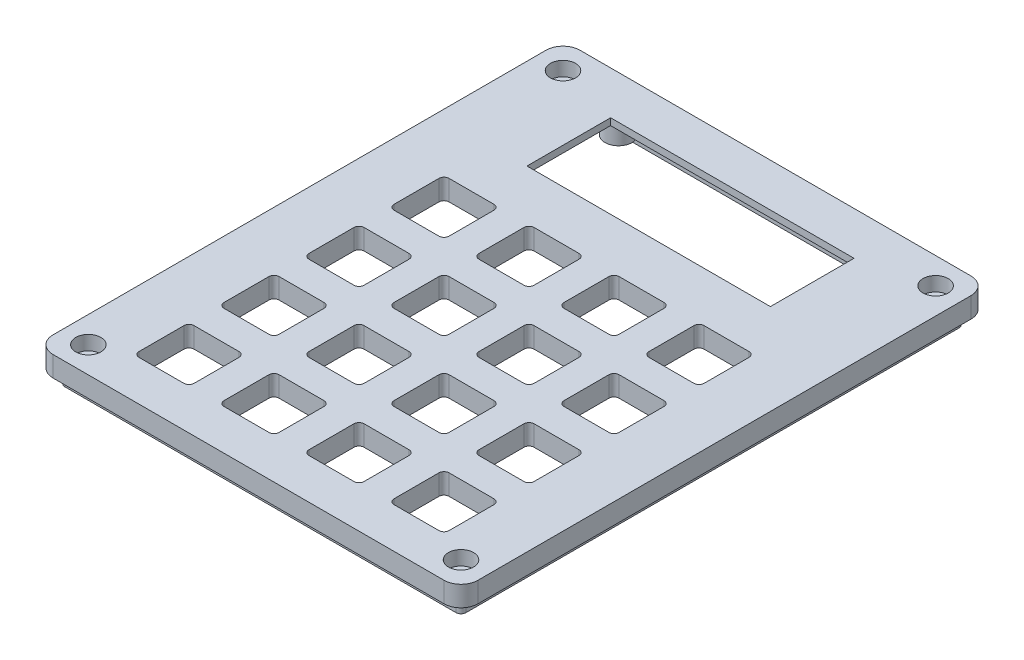
from build123d import *

# Parameters (mm, degrees)
BOSS_EXTRUDE1_DEPTH  = 6
CUT_EXTRUDE1_DEPTH   = 200.213453361
LPATTERN1_COUNT      = 4
LPATTERN1_PITCH      = 25
LPATTERN1_COUNT_DIR2 = 4
LPATTERN1_PITCH_DIR2 = 25
SKETCH4_W            = 71.6
SKETCH4_H            = 24.6
CUT_EXTRUDE2_DEPTH   = 200.213453361
SKETCH3_W            = 113.6
SKETCH3_H            = 143.6
BOSS_EXTRUDE2_DEPTH  = 4
HOLE2_D              = 4.5
HOLE2_DEPTH          = 10
HOLE2_CBORE_D        = 7.4
HOLE2_CBORE_DEPTH    = 4.2
HOLE2_TIP            = 1.351936393
SKETCH8_R            = 4
BOSS_EXTRUDE3_DEPTH  = 1
HOLE1_D              = 4.5
HOLE1_DEPTH          = 4.5
CUT_EXTRUDE3_START   = -4
CUT_EXTRUDE3_DEPTH   = 4


# Read off the part's stored shape, not the designer's step: Ø4.0mm Dowel Hole1
with BuildPart() as part:
    # Sketch1 → Boss-Extrude1 (new body)
    with BuildSketch(Plane(origin=(0, 0, 0), x_dir=(1, 0, 0), z_dir=(0, 1, 0))):
        with BuildLine():
            Line((-5, 0), (-120, 0))
            ThreePointArc((-120, 0), (-123.535533906, -1.464466094), (-125, -5))
            Line((-125, -5), (-125, -150))
            ThreePointArc((-125, -150), (-123.535533906, -153.535533906), (-120, -155))
            Line((-120, -155), (-5, -155))
            ThreePointArc((-5, -155), (-1.464466094, -153.535533906), (0, -150))
            Line((0, -150), (0, -5))
            ThreePointArc((0, -5), (-1.464466094, -1.464466094), (-5, 0))
        make_face()
    extrude(amount=BOSS_EXTRUDE1_DEPTH)

    # Sketch2 → Cut-Extrude1 (cut, through all)
    with BuildSketch(Plane(origin=(0, 6, 0), x_dir=(1, 0, 0), z_dir=(0, 1, 0))):
        with BuildLine():
            Line((-106.6, -143.1), (-93.4, -143.1))
            ThreePointArc((-93.4, -143.1), (-92.339339828, -142.660660172), (-91.9, -141.6))
            Line((-91.9, -141.6), (-91.9, -128.4))
            ThreePointArc((-91.9, -128.4), (-92.339339828, -127.339339828), (-93.4, -126.9))
            Line((-93.4, -126.9), (-106.6, -126.9))
            ThreePointArc((-106.6, -126.9), (-107.660660172, -127.339339828), (-108.1, -128.4))
            Line((-108.1, -128.4), (-108.1, -141.6))
            ThreePointArc((-108.1, -141.6), (-107.660660172, -142.660660172), (-106.6, -143.1))
        make_face()
    cut_extrude1 = extrude(amount=-CUT_EXTRUDE1_DEPTH, mode=Mode.SUBTRACT)

    # LPattern1: Cut-Extrude1 4 × 4
    with Locations(*[(i * LPATTERN1_PITCH, 0, -j * LPATTERN1_PITCH_DIR2) for i in range(LPATTERN1_COUNT) for j in range(LPATTERN1_COUNT_DIR2) if (i, j) != (0, 0)]):
        add(cut_extrude1, mode=Mode.SUBTRACT)

    # Sketch4 → Cut-Extrude2 (cut, through all)
    with BuildSketch(Plane(origin=(0, 6, 0), x_dir=(1, 0, 0), z_dir=(0, 1, 0))):
        with Locations((-62.5, -25)):
            Rectangle(SKETCH4_W, SKETCH4_H)
    extrude(amount=-CUT_EXTRUDE2_DEPTH, mode=Mode.SUBTRACT)

    # Sketch3 → Boss-Extrude2 (add)
    # profile 1 of 5: a face of its own
    with BuildSketch(Plane.XZ):
        with BuildLine():
            Line((-120, 3.5), (-5, 3.5))
            ThreePointArc((-5, 3.5), (-3.939339828, 3.939339828), (-3.5, 5))
            Line((-3.5, 5), (-3.5, 150))
            ThreePointArc((-3.5, 150), (-3.939339828, 151.060660172), (-5, 151.5))
            Line((-5, 151.5), (-120, 151.5))
            ThreePointArc((-120, 151.5), (-121.060660172, 151.060660172), (-121.5, 150))
            Line((-121.5, 150), (-121.5, 5))
            ThreePointArc((-121.5, 5), (-121.060660172, 3.939339828), (-120, 3.5))
        make_face()
        with Locations((-62.5, 77.5)):
            Rectangle(SKETCH3_W, SKETCH3_H, mode=Mode.SUBTRACT)
    # profile 2 of 5: a face of its own
    with BuildSketch(Plane.XZ):
        with BuildLine():
            Line((-7.7, 143.3), (-5.7, 143.3))
            Line((-5.7, 143.3), (-5.7, 149.3))
            Line((-5.7, 149.3), (-11.7, 149.3))
            Line((-11.7, 149.3), (-11.7, 147.3))
            ThreePointArc((-11.7, 147.3), (-10.528427125, 144.471572875), (-7.7, 143.3))
        make_face()
    # profile 3 of 5: a face of its own
    with BuildSketch(Plane.XZ):
        with BuildLine():
            Line((-119.3, 149.3), (-119.3, 143.3))
            Line((-119.3, 143.3), (-117.3, 143.3))
            ThreePointArc((-117.3, 143.3), (-114.471572875, 144.471572875), (-113.3, 147.3))
            Line((-113.3, 147.3), (-113.3, 149.3))
            Line((-113.3, 149.3), (-119.3, 149.3))
        make_face()
    # profile 4 of 5: a face of its own
    with BuildSketch(Plane.XZ):
        with BuildLine():
            Line((-11.7, 7.7), (-11.7, 5.7))
            Line((-11.7, 5.7), (-5.7, 5.7))
            Line((-5.7, 5.7), (-5.7, 11.7))
            Line((-5.7, 11.7), (-7.7, 11.7))
            ThreePointArc((-7.7, 11.7), (-10.528427125, 10.528427125), (-11.7, 7.7))
        make_face()
    # profile 5 of 5: a face of its own
    with BuildSketch(Plane.XZ):
        with BuildLine():
            Line((-113.3, 5.7), (-113.3, 7.7))
            ThreePointArc((-113.3, 7.7), (-114.471572875, 10.528427125), (-117.3, 11.7))
            Line((-117.3, 11.7), (-119.3, 11.7))
            Line((-119.3, 11.7), (-119.3, 5.7))
            Line((-119.3, 5.7), (-113.3, 5.7))
        make_face()
    extrude(amount=BOSS_EXTRUDE2_DEPTH)

    # Hole2
    with Locations(Plane(origin=(-117.3, 6, 7.7), x_dir=(0, 0, 1), z_dir=(0, 1, 0))):
        with Locations((0, 0), (0, 109.6), (139.6, 109.6), (139.6, 0)):
            CounterBoreHole(HOLE2_D / 2, HOLE2_CBORE_D / 2, HOLE2_CBORE_DEPTH, depth=HOLE2_DEPTH)
            with Locations((0, 0, -(HOLE2_DEPTH + HOLE2_TIP / 2))):  # 118° drill point
                Cone(0, HOLE2_D / 2, HOLE2_TIP, mode=Mode.SUBTRACT)

    # Ø4.0mm Dowel Hole1 outline → Ø4.0mm Dowel Hole1 (revolve, cut)
    with BuildSketch(Plane(origin=(-15, 0, 145), x_dir=(1, 0, 0), z_dir=(0, 0, 1))):
        Polygon((2.25, 4.5), (0, 5.851936393), (0, 0), (2.25, 0), align=None)
    revolve(axis=Axis((-15, 0, 145), (0, 1, 0)), mode=Mode.SUBTRACT)

    # 4.0mm Dowel Hole1 2 outline → 4.0mm Dowel Hole1 2 (revolve, cut)
    with BuildSketch(Plane(origin=(-60, 0, 145), x_dir=(1, 0, 0), z_dir=(0, 0, 1))):
        Polygon((2.25, 4.5), (0, 5.851936393), (0, 0), (2.25, 0), align=None)
    revolve(axis=Axis((-60, 0, 145), (0, 1, 0)), mode=Mode.SUBTRACT)

    # 4.0mm Dowel Hole1 3 outline → 4.0mm Dowel Hole1 3 (revolve, cut)
    with BuildSketch(Plane(origin=(-110, 0, 145), x_dir=(1, 0, 0), z_dir=(0, 0, 1))):
        Polygon((2.25, 4.5), (0, 5.851936393), (0, 0), (2.25, 0), align=None)
    revolve(axis=Axis((-110, 0, 145), (0, 1, 0)), mode=Mode.SUBTRACT)

    # 4.0mm Dowel Hole1 4 outline → 4.0mm Dowel Hole1 4 (revolve, cut)
    with BuildSketch(Plane(origin=(-110, 0, 95), x_dir=(1, 0, 0), z_dir=(0, 0, 1))):
        Polygon((2.25, 4.5), (0, 5.851936393), (0, 0), (2.25, 0), align=None)
    revolve(axis=Axis((-110, 0, 95), (0, 1, 0)), mode=Mode.SUBTRACT)

    # 4.0mm Dowel Hole1 5 outline → 4.0mm Dowel Hole1 5 (revolve, cut)
    with BuildSketch(Plane(origin=(-110, 0, 50), x_dir=(1, 0, 0), z_dir=(0, 0, 1))):
        Polygon((2.25, 4.5), (0, 5.851936393), (0, 0), (2.25, 0), align=None)
    revolve(axis=Axis((-110, 0, 50), (0, 1, 0)), mode=Mode.SUBTRACT)

    # 4.0mm Dowel Hole1 6 outline → 4.0mm Dowel Hole1 6 (revolve, cut)
    with BuildSketch(Plane(origin=(-15, 0, 100), x_dir=(1, 0, 0), z_dir=(0, 0, 1))):
        Polygon((2.25, 4.5), (0, 5.851936393), (0, 0), (2.25, 0), align=None)
    revolve(axis=Axis((-15, 0, 100), (0, 1, 0)), mode=Mode.SUBTRACT)

    # 4.0mm Dowel Hole1 7 outline → 4.0mm Dowel Hole1 7 (revolve, cut)
    with BuildSketch(Plane(origin=(-65, 0, 100), x_dir=(1, 0, 0), z_dir=(0, 0, 1))):
        Polygon((2.25, 4.5), (0, 5.851936393), (0, 0), (2.25, 0), align=None)
    revolve(axis=Axis((-65, 0, 100), (0, 1, 0)), mode=Mode.SUBTRACT)

    # 4.0mm Dowel Hole1 8 outline → 4.0mm Dowel Hole1 8 (revolve, cut)
    with BuildSketch(Plane(origin=(-60, 0, 95), x_dir=(1, 0, 0), z_dir=(0, 0, 1))):
        Polygon((2.25, 4.5), (0, 5.851936393), (0, 0), (2.25, 0), align=None)
    revolve(axis=Axis((-60, 0, 95), (0, 1, 0)), mode=Mode.SUBTRACT)

    # 4.0mm Dowel Hole1 9 outline → 4.0mm Dowel Hole1 9 (revolve, cut)
    with BuildSketch(Plane(origin=(-65, 0, 50), x_dir=(1, 0, 0), z_dir=(0, 0, 1))):
        Polygon((2.25, 4.5), (0, 5.851936393), (0, 0), (2.25, 0), align=None)
    revolve(axis=Axis((-65, 0, 50), (0, 1, 0)), mode=Mode.SUBTRACT)

    # 4.0mm Dowel Hole1 10 outline → 4.0mm Dowel Hole1 10 (revolve, cut)
    with BuildSketch(Plane(origin=(-15, 0, 50), x_dir=(1, 0, 0), z_dir=(0, 0, 1))):
        Polygon((2.25, 4.5), (0, 5.851936393), (0, 0), (2.25, 0), align=None)
    revolve(axis=Axis((-15, 0, 50), (0, 1, 0)), mode=Mode.SUBTRACT)

    # Sketch8 → Boss-Extrude3 (add)
    with BuildSketch(Plane.XZ):
        with BuildLine():
            ThreePointArc((-26.7, 36.17788578), (-22.356409192, 42.837093423), (-28.061882351, 37.3))
            Line((-28.061882351, 37.3), (-26.7, 37.3))
            Line((-26.7, 37.3), (-26.7, 36.17788578))
        make_face()
        with BuildLine():
            ThreePointArc((-96.638117649, 37.3), (-102.214330174, 42.939202065), (-98.3, 36.041900756))
            Line((-98.3, 36.041900756), (-98.3, 37.3))
            Line((-98.3, 37.3), (-96.638117649, 37.3))
        make_face()
        with Locations((-24.9, 8.85)):
            Circle(SKETCH8_R)
        with Locations((-99.8, 8.85)):
            Circle(SKETCH8_R)
    extrude(amount=BOSS_EXTRUDE3_DEPTH)

    # Hole1
    with Locations(Plane(origin=(0, -1, 0), x_dir=(-1, 0, 0), z_dir=(0, -1, 0))):
        with Locations((24.9, -39.75), (99.8, -39.75), (99.8, -8.85), (24.9, -8.85)):
            Hole(HOLE1_D / 2, depth=HOLE1_DEPTH)

    # Sketch12 → Cut-Extrude3 (cut)
    with BuildSketch(Plane.XZ.offset(CUT_EXTRUDE3_START)):
        with BuildLine():
            Line((-5.7, 45.6), (-119.3, 45.6))
            Line((-119.3, 45.6), (-119.3, 14.6))
            Line((-119.3, 14.6), (-117.3, 14.6))
            ThreePointArc((-117.3, 14.6), (-112.42096321, 12.57903679), (-110.4, 7.7))
            Line((-110.4, 7.7), (-110.4, 5.7))
            Line((-110.4, 5.7), (-102.265258607, 5.7))
            ThreePointArc((-102.265258607, 5.7), (-99.8, 12.85), (-97.334741393, 5.7))
            Line((-97.334741393, 5.7), (-27.365258607, 5.7))
            ThreePointArc((-27.365258607, 5.7), (-24.9, 12.85), (-22.434741393, 5.7))
            Line((-22.434741393, 5.7), (-14.6, 5.7))
            Line((-14.6, 5.7), (-14.6, 7.7))
            ThreePointArc((-14.6, 7.7), (-12.57903679, 12.57903679), (-7.7, 14.6))
            Line((-7.7, 14.6), (-5.7, 14.6))
            Line((-5.7, 14.6), (-5.7, 45.6))
        make_face()
        with BuildLine():
            Line((-98.3, 12.7), (-98.3, 36.041900756))
            ThreePointArc((-98.3, 36.041900756), (-102.214330174, 42.939202065), (-96.638117649, 37.3))
            Line((-96.638117649, 37.3), (-28.061882351, 37.3))
            ThreePointArc((-28.061882351, 37.3), (-22.356409192, 42.837093423), (-26.7, 36.17788578))
            Line((-26.7, 36.17788578), (-26.7, 12.7))
            Line((-26.7, 12.7), (-98.3, 12.7))
        make_face(mode=Mode.SUBTRACT)
    extrude(amount=CUT_EXTRUDE3_DEPTH, mode=Mode.SUBTRACT)


solid = part.part
